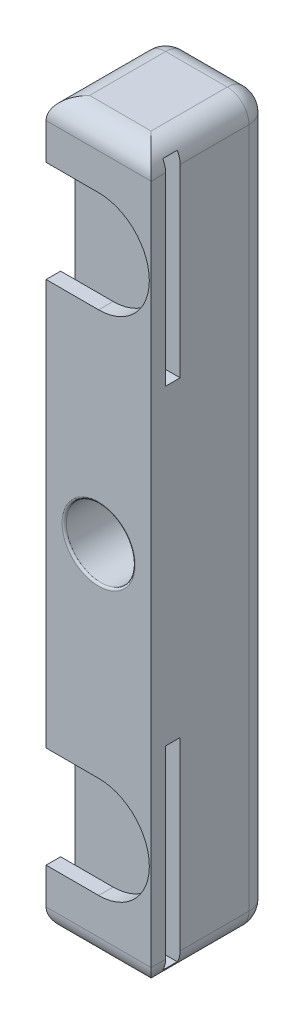
from build123d import *

# Parameters (mm, degrees)
SKETCH7_W           = 100
SKETCH7_H           = 14.5
BOSS_EXTRUDE1_DEPTH = 16.5
SKETCH8_R           = 4.75
CUT_EXTRUDE2_DEPTH  = 16
CUT_EXTRUDE3_START  = -2
SKETCH9_W           = 27
SKETCH9_H           = 27
CUT_EXTRUDE3_DEPTH  = 2
CUT_EXTRUDE4_DEPTH  = 2
FILLET1_R           = 3
FILLET2_R           = 3
FILLET3_R           = 0.3
FILLET4_R           = 3


with BuildPart() as part:
    # Sketch7 → Boss-Extrude1 (new body)
    with BuildSketch(Plane(origin=(0, 0, 0), x_dir=(0, 1, 0), z_dir=(0, 0, 1))):
        Rectangle(SKETCH7_W, SKETCH7_H)
    extrude(amount=BOSS_EXTRUDE1_DEPTH)

    # Sketch8 → Cut-Extrude2 (cut)
    with BuildSketch(Plane(origin=(0, 0, 16.5), x_dir=(0, -1, 0), z_dir=(0, 0, 1))):
        with Locations(Location((0, 0, 0), (0, 0, 90))):
            Circle(SKETCH8_R)
    extrude(amount=-CUT_EXTRUDE2_DEPTH, mode=Mode.SUBTRACT)

    # Sketch9 → Cut-Extrude3 (cut)
    with BuildSketch(Plane.XY.offset(16.5).offset(CUT_EXTRUDE3_START)):
        with Locations((0, -35)):
            Rectangle(SKETCH9_W, SKETCH9_H)
    cut_extrude3 = extrude(amount=-CUT_EXTRUDE3_DEPTH, mode=Mode.SUBTRACT)

    # Sketch10 → Cut-Extrude4 (cut)
    with BuildSketch(Plane.XY.offset(16.5)):
        with BuildLine():
            Line((0, -28), (-7.25, -28))
            Line((-7.25, -28), (-7.25, -42))
            Line((-7.25, -42), (0, -42))
            ThreePointArc((0, -42), (7, -35), (0, -28))
        make_face()
    cut_extrude4 = extrude(amount=-CUT_EXTRUDE4_DEPTH, mode=Mode.SUBTRACT)

    # Mirror1: Cut-Extrude3 across plane
    add(cut_extrude3.mirror(Plane.ZX), mode=Mode.SUBTRACT)

    # Mirror2: Cut-Extrude4 across plane
    add(cut_extrude4.mirror(Plane.ZX), mode=Mode.SUBTRACT)

    # Fillet1
    fillet1_edges = [part.edges().sort_by_distance(p)[0] for p in [
        (-7.25, 0, 0),
    ]]
    fillet(fillet1_edges, radius=FILLET1_R)

    # Fillet2
    fillet2_edges = [part.edges().sort_by_distance(p)[0] for p in [
        (7.25, 0, 0),
    ]]
    fillet(fillet2_edges, radius=FILLET2_R)

    # Fillet3
    fillet3_edges = [part.edges().sort_by_distance(p)[0] for p in [
        (-4.75, 0, 16.5),
    ]]
    fillet(fillet3_edges, radius=FILLET3_R)

    # Fillet4
    # the kernel refuses this fillet: 3 mm, written as the material it takes off along each edge
    with BuildSketch(Plane(origin=(-4.25, -50, 3), x_dir=(0, 0, -1), z_dir=(1, 0, 0))) as fillet4_piece_1:
        with BuildLine():
            CenterArc((3 - FILLET4_R, FILLET4_R), FILLET4_R, 270, 90)
            Line((3, FILLET4_R), (3, 0))
            Line((3, 0), (3 - FILLET4_R, 0))
        make_face()
    revolve(axis=Axis((-4.25, -50, 3), (0, 1, 0)), revolution_arc=90, mode=Mode.SUBTRACT)
    with BuildSketch(Plane(origin=(-7.25, -50, 3), x_dir=(0, 1, 0), z_dir=(0, 0, 1))) as fillet4_piece_2:
        with BuildLine():
            CenterArc((FILLET4_R, -FILLET4_R), FILLET4_R, 90, 90)
            Line((0, -FILLET4_R), (0, 0))
            Line((0, 0), (FILLET4_R, 0))
        make_face()
    extrude(amount=21, mode=Mode.SUBTRACT)
    with BuildSketch(Plane(origin=(-14.75, -50, 16.5), x_dir=(0, 1, 0), z_dir=(1, 0, 0)), Plane(origin=(14.75, 50, 16.5), x_dir=(0, -1, 0), z_dir=(-1, 0, 0))) as fillet4_piece_3:
        with BuildLine():
            CenterArc((FILLET4_R, -FILLET4_R), FILLET4_R, 90, 90)
            Line((0, -FILLET4_R), (0, 0))
            Line((0, 0), (FILLET4_R, 0))
        make_face()
    extrude(amount=29.5, mode=Mode.SUBTRACT)
    with BuildSketch(Plane(origin=(7.25, -50, 3), x_dir=(0, 1, 0), z_dir=(0, 0, 1)), Plane(origin=(-7.25, 50, 3), x_dir=(0, -1, 0), z_dir=(0, 0, 1)), Plane(origin=(7.25, 50, 3), x_dir=(-1, 0, 0), z_dir=(0, 0, 1))) as fillet4_piece_4:
        with BuildLine():
            CenterArc((FILLET4_R, FILLET4_R), FILLET4_R, 180, 90)
            Line((0, FILLET4_R), (0, 0))
            Line((0, 0), (FILLET4_R, 0))
        make_face()
    extrude(amount=21, mode=Mode.SUBTRACT)
    with BuildSketch(Plane(origin=(4.25, -50, 3), x_dir=(0, 0, -1), z_dir=(-1, 0, 0))) as fillet4_piece_5:
        with BuildLine():
            CenterArc((3 - FILLET4_R, -FILLET4_R), FILLET4_R, 0, 90)
            Line((3, -FILLET4_R), (3, 0))
            Line((3, 0), (3 - FILLET4_R, 0))
        make_face()
    revolve(axis=Axis((4.25, -50, 3), (0, -1, 0)), revolution_arc=90, mode=Mode.SUBTRACT)
    with BuildSketch(Plane(origin=(-4.25, -50, 0), x_dir=(0, 0, 1), z_dir=(1, 0, 0)), Plane(origin=(4.25, 50, 0), x_dir=(0, 0, 1), z_dir=(-1, 0, 0))) as fillet4_piece_6:
        with BuildLine():
            CenterArc((FILLET4_R, -FILLET4_R), FILLET4_R, 90, 90)
            Line((0, -FILLET4_R), (0, 0))
            Line((0, 0), (FILLET4_R, 0))
        make_face()
    extrude(amount=8.5, mode=Mode.SUBTRACT)
    with BuildSketch(Plane(origin=(-4.25, 50, 3), x_dir=(0, 0, -1), z_dir=(1, 0, 0))) as fillet4_piece_7:
        with BuildLine():
            CenterArc((3 - FILLET4_R, -FILLET4_R), FILLET4_R, 0, 90)
            Line((3, -FILLET4_R), (3, 0))
            Line((3, 0), (3 - FILLET4_R, 0))
        make_face()
    revolve(axis=Axis((-4.25, 50, 3), (0, 1, 0)), revolution_arc=90, mode=Mode.SUBTRACT)
    with BuildSketch(Plane(origin=(4.25, 50, 3), x_dir=(0, 0, -1), z_dir=(-1, 0, 0))) as fillet4_piece_8:
        with BuildLine():
            CenterArc((3 - FILLET4_R, FILLET4_R), FILLET4_R, 270, 90)
            Line((3, FILLET4_R), (3, 0))
            Line((3, 0), (3 - FILLET4_R, 0))
        make_face()
    revolve(axis=Axis((4.25, 50, 3), (0, -1, 0)), revolution_arc=90, mode=Mode.SUBTRACT)


solid = part.part
